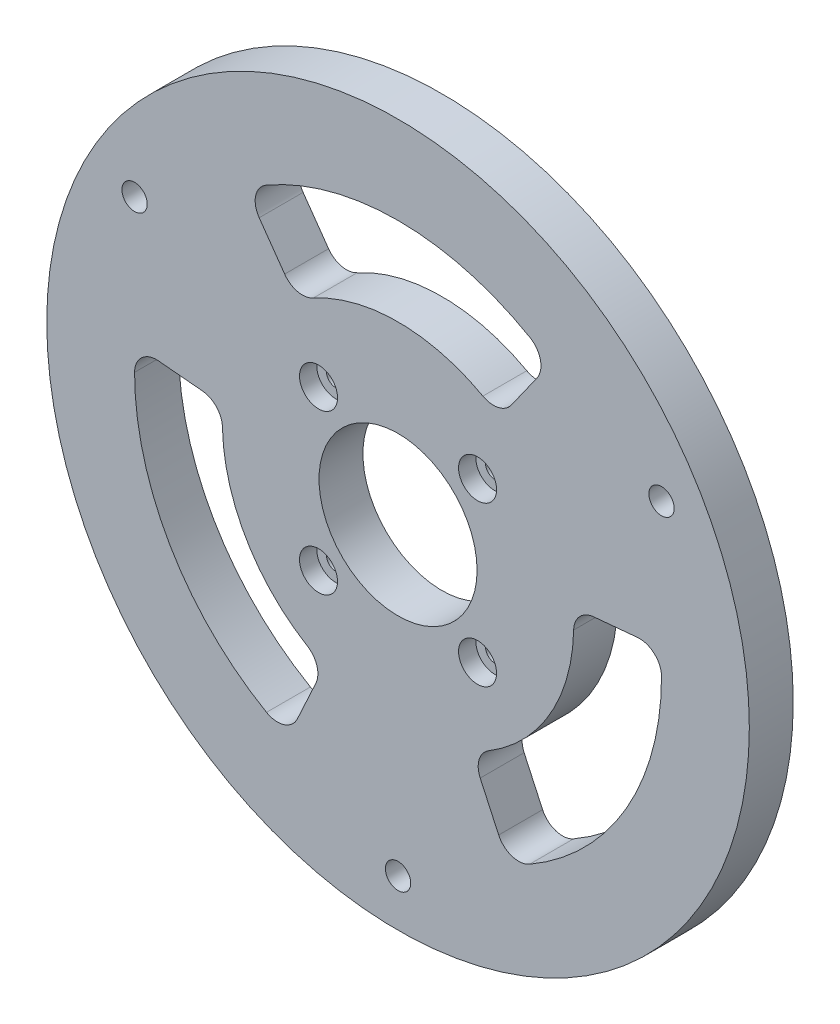
from build123d import *

# Parameters (mm, degrees)
SKETCH1_R                        = 50.8
BOSS_EXTRUDE1_DEPTH              = 6.35
SKETCH2_R                        = 11.43
CUT_EXTRUDE1_DEPTH               = 73.122135992
CBORE_FOR_M2_5_SHCS1_D           = 2.7
CBORE_FOR_M2_5_SHCS1_DEPTH       = 10.16
CBORE_FOR_M2_5_SHCS1_CBORE_D     = 5.5
CBORE_FOR_M2_5_SHCS1_CBORE_DEPTH = 2.5
CBORE_FOR_M2_5_SHCS1_TIP         = 0.811161836
F_6_CLEARANCE_HOLE1_D            = 3.6576
F_6_CLEARANCE_HOLE1_DEPTH        = 10.16
F_6_CLEARANCE_HOLE1_TIP          = 1.0988539
CUT_EXTRUDE2_DEPTH               = 73.122135992
FILLET2_R                        = 3.175
CIRPATTERN1_COUNT                = 3
FILLET2_OF_CIRPATTERN1_R         = 3.175


with BuildPart() as part:
    # Sketch1 → Boss-Extrude1 (new body)
    with BuildSketch(Plane.XY):
        Circle(SKETCH1_R)
    extrude(amount=BOSS_EXTRUDE1_DEPTH)

    # Sketch2 → Cut-Extrude1 (cut, through all)
    with BuildSketch(Plane.XY.offset(6.35)):
        Circle(SKETCH2_R)
    extrude(amount=-CUT_EXTRUDE1_DEPTH, mode=Mode.SUBTRACT)

    # CBORE for M2.5 SHCS1
    with Locations(Plane.XY.offset(6.35)):
        with Locations((0, 0), (11.5, 11.5), (-11.5, -11.5), (-11.5, 11.5), (11.5, -11.5)):
            CounterBoreHole(CBORE_FOR_M2_5_SHCS1_D / 2, CBORE_FOR_M2_5_SHCS1_CBORE_D / 2, CBORE_FOR_M2_5_SHCS1_CBORE_DEPTH, depth=CBORE_FOR_M2_5_SHCS1_DEPTH)
            with Locations((0, 0, -(CBORE_FOR_M2_5_SHCS1_DEPTH + CBORE_FOR_M2_5_SHCS1_TIP / 2))):  # 118° drill point
                Cone(0, CBORE_FOR_M2_5_SHCS1_D / 2, CBORE_FOR_M2_5_SHCS1_TIP, mode=Mode.SUBTRACT)

    # #6 Clearance Hole1
    with Locations(Plane.XY.offset(6.35)):
        with Locations((-38.1, 21.997045256), (0, -43.994090512), (38.1, 21.997045256)):
            Hole(F_6_CLEARANCE_HOLE1_D / 2, depth=F_6_CLEARANCE_HOLE1_DEPTH)
            with Locations((0, 0, -(F_6_CLEARANCE_HOLE1_DEPTH + F_6_CLEARANCE_HOLE1_TIP / 2))):  # 118° drill point
                Cone(0, F_6_CLEARANCE_HOLE1_D / 2, F_6_CLEARANCE_HOLE1_TIP, mode=Mode.SUBTRACT)

    # Sketch10 → Cut-Extrude2 (cut, through all)
    with BuildSketch(Plane.XY.offset(6.35)):
        with BuildLine():
            Line((14.664933069, 20.738846113), (21.997399604, 31.108269169))
            ThreePointArc((21.997399604, 31.108269169), (0, 38.1), (-21.997399604, 31.108269169))
            Line((-21.997399604, 31.108269169), (-14.664933069, 20.738846113))
            ThreePointArc((-14.664933069, 20.738846113), (0, 25.4), (14.664933069, 20.738846113))
        make_face()
    cut_extrude2 = extrude(amount=-CUT_EXTRUDE2_DEPTH, mode=Mode.SUBTRACT)

    # Fillet2
    fillet2_edges = [part.edges().sort_by_distance(p)[0] for p in [
        (-14.664933069, 20.738846113, 3.175),
        (14.664933069, 20.738846113, 3.175),
        (21.997399604, 31.108269169, 3.175),
        (-21.997399604, 31.108269169, 3.175),
    ]]
    fillet(fillet2_edges, radius=FILLET2_R)

    # CirPattern1: Cut-Extrude2 ×3 about axis
    cirpattern1_axis = Axis((0, 0, 6.35), (0, 0, 1))
    for i in range(1, CIRPATTERN1_COUNT):
        add(cut_extrude2.rotate(cirpattern1_axis, i * 360 / CIRPATTERN1_COUNT), mode=Mode.SUBTRACT)

    # Fillet2 of CirPattern1
    fillet2_of_cirpattern1_edges = [part.edges().sort_by_distance(p)[0] for p in [
        (-10.627901044, -23.069627639, 3.175),
        (-25.292834113, 2.330781526, 3.175),
        (-37.93925117, 3.49617229, 3.175),
        (-15.941851566, -34.604441458, 3.175),
        (25.292834113, 2.330781526, 3.175),
        (10.627901044, -23.069627639, 3.175),
        (15.941851566, -34.604441458, 3.175),
        (37.93925117, 3.49617229, 3.175),
    ]]
    fillet(fillet2_of_cirpattern1_edges, radius=FILLET2_OF_CIRPATTERN1_R)


solid = part.part
